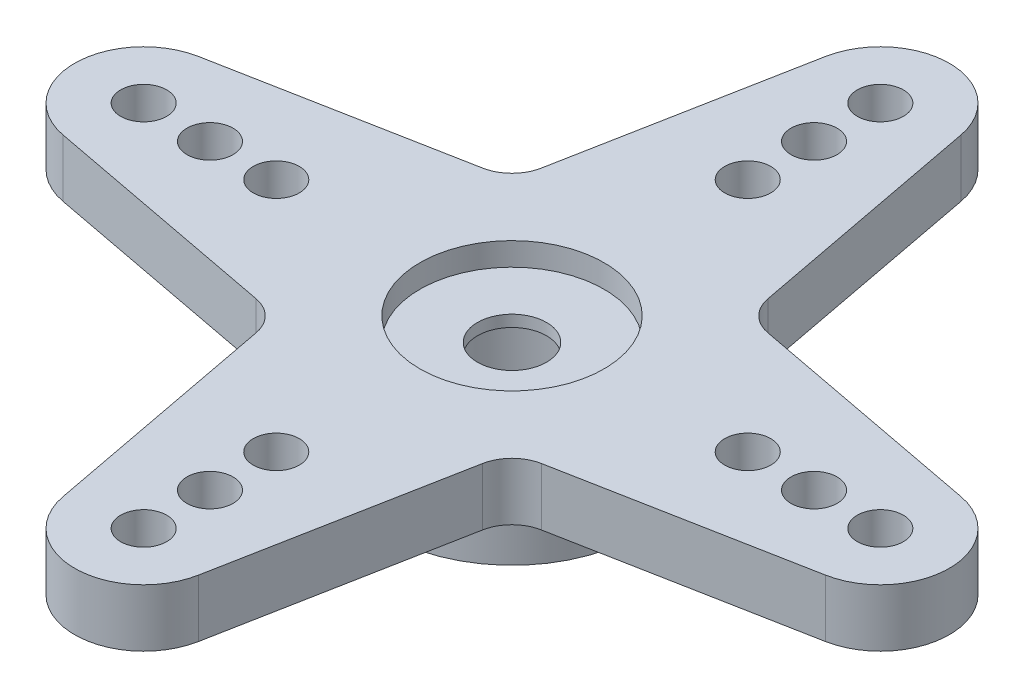
from build123d import *

# Parameters (mm, degrees)
SKETCH1_R           = 1.190625
SKETCH1_R_2         = 0.79375
BOSS_EXTRUDE1_DEPTH = 1.984375
SKETCH2_R           = 3.175
CUT_EXTRUDE1_DEPTH  = 0.79375
SKETCH3_R           = 4.365625
BOSS_EXTRUDE2_DEPTH = 2.38125
SKETCH4_R           = 2.778125
CUT_EXTRUDE2_DEPTH  = 3.175


with BuildPart() as part:
    # Sketch1 → Boss-Extrude1 (new body)
    with BuildSketch(Plane(origin=(0, 0, 0), x_dir=(1, 0, 0), z_dir=(0, 1, 0))):
        with BuildLine():
            Line((-3.904422951, 4.914801854), (-2.339326011, 13.144865569))
            ThreePointArc((-2.339326011, 13.144865569), (0, 15.08125), (2.339326011, 13.144865569))
            Line((2.339326011, 13.144865569), (3.904422951, 4.914801854))
            ThreePointArc((3.904422951, 4.914801854), (4.254037879, 4.254037879), (4.914801854, 3.904422951))
            Line((4.914801854, 3.904422951), (13.144865569, 2.339326011))
            ThreePointArc((13.144865569, 2.339326011), (15.08125, 0), (13.144865569, -2.339326011))
            Line((13.144865569, -2.339326011), (4.914801854, -3.904422951))
            ThreePointArc((4.914801854, -3.904422951), (4.254037879, -4.254037879), (3.904422951, -4.914801854))
            Line((3.904422951, -4.914801854), (2.339326011, -13.144865569))
            ThreePointArc((2.339326011, -13.144865569), (0, -15.08125), (-2.339326011, -13.144865569))
            Line((-2.339326011, -13.144865569), (-3.904422951, -4.914801854))
            ThreePointArc((-3.904422951, -4.914801854), (-4.254037879, -4.254037879), (-4.914801854, -3.904422951))
            Line((-4.914801854, -3.904422951), (-13.144865569, -2.339326011))
            ThreePointArc((-13.144865569, -2.339326011), (-15.08125, 0), (-13.144865569, 2.339326011))
            Line((-13.144865569, 2.339326011), (-4.914801854, 3.904422951))
            ThreePointArc((-4.914801854, 3.904422951), (-4.254037879, 4.254037879), (-3.904422951, 4.914801854))
        make_face()
        Circle(SKETCH1_R, mode=Mode.SUBTRACT)
        with Locations((0, 12.7)):
            Circle(SKETCH1_R_2, mode=Mode.SUBTRACT)
        with Locations((0, 10.414)):
            Circle(SKETCH1_R_2, mode=Mode.SUBTRACT)
        with Locations((0, 8.128)):
            Circle(SKETCH1_R_2, mode=Mode.SUBTRACT)
        with Locations((12.7, 0)):
            Circle(SKETCH1_R_2, mode=Mode.SUBTRACT)
        with Locations((10.414, 0)):
            Circle(SKETCH1_R_2, mode=Mode.SUBTRACT)
        with Locations((8.128, 0)):
            Circle(SKETCH1_R_2, mode=Mode.SUBTRACT)
        with Locations((0, -12.7)):
            Circle(SKETCH1_R_2, mode=Mode.SUBTRACT)
        with Locations((0, -10.414)):
            Circle(SKETCH1_R_2, mode=Mode.SUBTRACT)
        with Locations((0, -8.128)):
            Circle(SKETCH1_R_2, mode=Mode.SUBTRACT)
        with Locations((-12.7, 0)):
            Circle(SKETCH1_R_2, mode=Mode.SUBTRACT)
        with Locations((-10.414, 0)):
            Circle(SKETCH1_R_2, mode=Mode.SUBTRACT)
        with Locations((-8.128, 0)):
            Circle(SKETCH1_R_2, mode=Mode.SUBTRACT)
    extrude(amount=BOSS_EXTRUDE1_DEPTH)

    # Sketch2 → Cut-Extrude1 (cut)
    with BuildSketch(Plane(origin=(0, 1.984375, 0), x_dir=(1, 0, 0), z_dir=(0, 1, 0))):
        Circle(SKETCH2_R)
    extrude(amount=-CUT_EXTRUDE1_DEPTH, mode=Mode.SUBTRACT)

    # Sketch3 → Boss-Extrude2 (add)
    with BuildSketch(Plane.XZ):
        Circle(SKETCH3_R)
    extrude(amount=BOSS_EXTRUDE2_DEPTH)

    # Sketch4 → Cut-Extrude2 (cut)
    with BuildSketch(Plane.XZ.offset(2.38125)):
        Circle(SKETCH4_R)
    extrude(amount=-CUT_EXTRUDE2_DEPTH, mode=Mode.SUBTRACT)


solid = part.part
